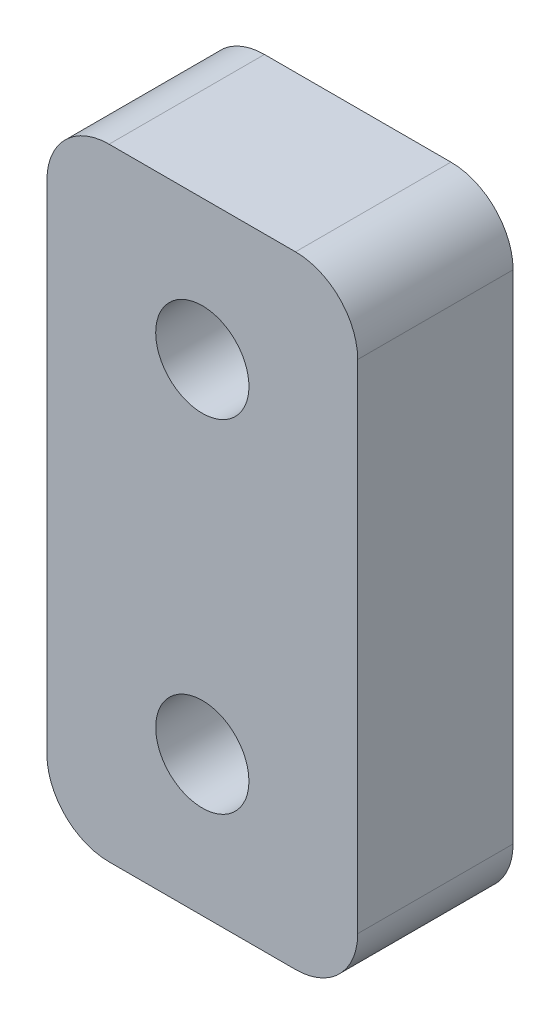
from build123d import *

# Parameters (mm, degrees)
SKETCH_2_W          = 10
SKETCH_2_H          = 20
EXTRUDE_1_DEPTH     = 5
SKETCH_3_R          = 1.5
CUT_EXTRUDE_1_DEPTH = 13.247448714
FILLET_1_R          = 2


with BuildPart() as part:
    # 草图2 → 凸台-拉伸1 (new body)
    with BuildSketch(Plane.XY):
        Rectangle(SKETCH_2_W, SKETCH_2_H)
    extrude(amount=EXTRUDE_1_DEPTH)

    # 草图3 → 切除-拉伸1 (cut, through all)
    with BuildSketch(Plane.XY.offset(5)):
        with Locations((0, -5.5)):
            Circle(SKETCH_3_R)
        with Locations((0, 5.5)):
            Circle(SKETCH_3_R)
    extrude(amount=-CUT_EXTRUDE_1_DEPTH, mode=Mode.SUBTRACT)

    # 圆角1
    fillet_1_edges = [part.edges().sort_by_distance(p)[0] for p in [
        (5, -10, 2.5),
        (-5, -10, 2.5),
        (5, 10, 2.5),
        (-5, 10, 2.5),
    ]]
    fillet(fillet_1_edges, radius=FILLET_1_R)


solid = part.part
